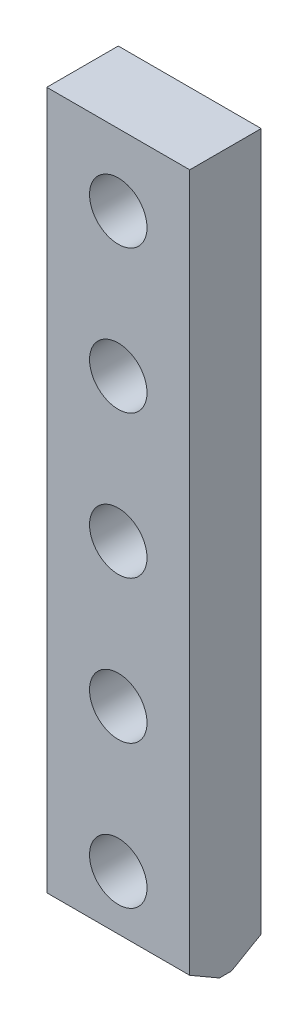
from build123d import *

# Parameters (mm, degrees)
SKETCH_1_W          = 50
SKETCH_1_H          = 250
EXTRUDE_1_DEPTH     = 25
SKETCH_2_R          = 10.05
CUT_EXTRUDE_1_DEPTH = 257.173769149
CHAMFER_1_SIZE      = 6
CHAMFER_1_SIZE2     = 10.392304845
CHAMFER_2_SIZE      = 6
CHAMFER_2_SIZE2     = 10.392304845


with BuildPart() as part:
    # Эскиз1 → Бобышка-Вытянуть1 (new body)
    with BuildSketch(Plane.XY):
        with Locations((25, 125)):
            Rectangle(SKETCH_1_W, SKETCH_1_H)
    extrude(amount=EXTRUDE_1_DEPTH)

    # Эскиз2 → Вырез-Вытянуть1 (cut, through all)
    with BuildSketch(Plane.XY.offset(25)):
        with Locations((25, 25)):
            Circle(SKETCH_2_R)
        with Locations((25, 75)):
            Circle(SKETCH_2_R)
        with Locations((25, 125)):
            Circle(SKETCH_2_R)
        with Locations((25, 175)):
            Circle(SKETCH_2_R)
        with Locations((25, 225)):
            Circle(SKETCH_2_R)
    extrude(amount=-CUT_EXTRUDE_1_DEPTH, mode=Mode.SUBTRACT)

    # Фаска1
    chamfer_1_edges = [part.edges().sort_by_distance(p)[0] for p in [
        (25, 0, 0),
    ]]
    chamfer_1_side = [part.faces().sort_by_distance(p)[0] for p in [
        (25, 2.549509757, 0),
    ]]
    chamfer(chamfer_1_edges, length=CHAMFER_1_SIZE, length2=CHAMFER_1_SIZE2, reference=chamfer_1_side[0])

    # Фаска2
    chamfer_2_edges = [part.edges().sort_by_distance(p)[0] for p in [
        (25, 0, 25),
    ]]
    chamfer_2_side = [part.faces().sort_by_distance(p)[0] for p in [
        (25, 2.549509757, 25),
    ]]
    chamfer(chamfer_2_edges, length=CHAMFER_2_SIZE, length2=CHAMFER_2_SIZE2, reference=chamfer_2_side[0])


solid = part.part
